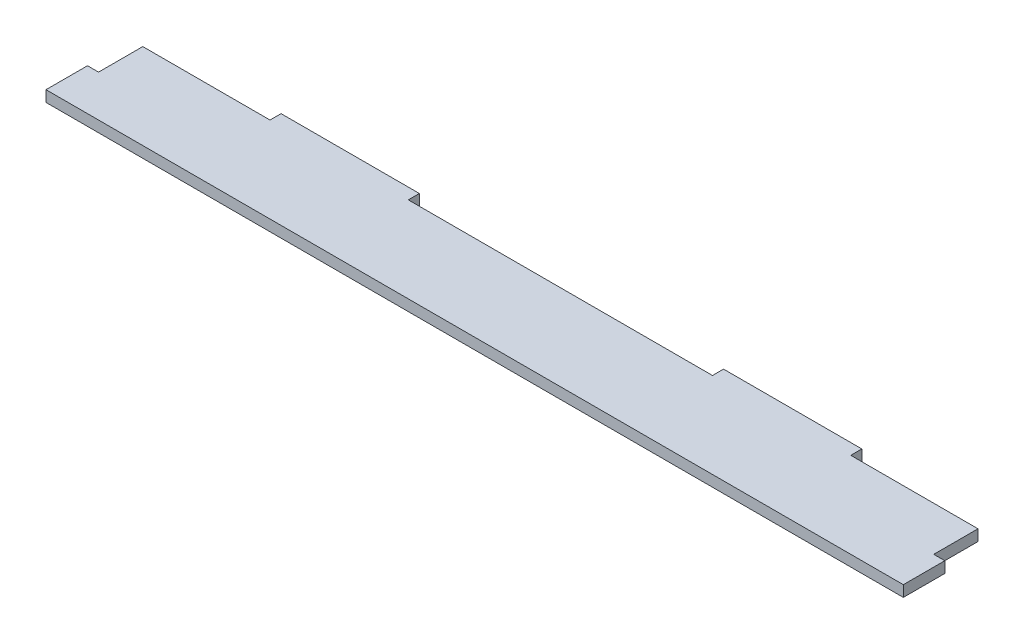
from build123d import *

# Parameters (mm, degrees)
CROQUIS1_W              = 310
CROQUIS1_H              = 35
SALIENTE_EXTRUIR1_DEPTH = 4
CROQUIS2_W              = 110
CROQUIS2_H              = 4
CORTAR_EXTRUIR2_DEPTH   = 10


with BuildPart() as part:
    # Croquis1 → Saliente-Extruir1 (new body)
    with BuildSketch(Plane(origin=(0, 0, 0), x_dir=(1, 0, 0), z_dir=(0, 1, 0))):
        Rectangle(CROQUIS1_W, CROQUIS1_H)
    extrude(amount=SALIENTE_EXTRUIR1_DEPTH)

    # Croquis2 → Cortar-Extruir2 (cut)
    with BuildSketch(Plane(origin=(0, 4, 0), x_dir=(1, 0, 0), z_dir=(0, 1, 0))):
        Polygon((-155, -2.5), (-151, -2.5), (-151, 13.5), (-105, 13.5), (-105, 17.5), (-151, 17.5), (-155, 17.5), align=None)
        Polygon((155, -2.5), (151, -2.5), (151, 13.5), (105, 13.5), (105, 17.5), (151, 17.5), (155, 17.5), align=None)
        with Locations((0, 15.5)):
            Rectangle(CROQUIS2_W, CROQUIS2_H)
    extrude(amount=-CORTAR_EXTRUIR2_DEPTH, mode=Mode.SUBTRACT)


solid = part.part
